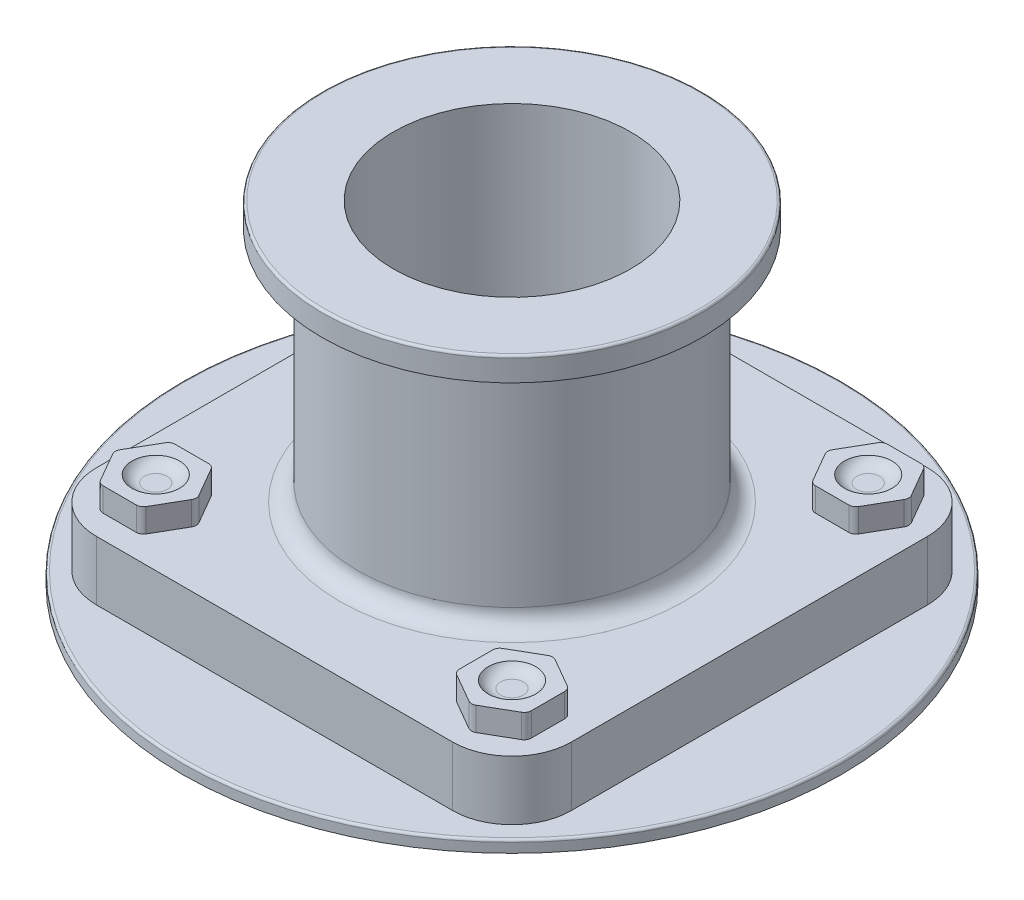
from build123d import *

# Parameters (mm, degrees)
SKETCH1_R                = 277.5
BOSS_EXTRUDE1_DEPTH      = 10
SKETCH2_W                = 400
SKETCH2_H                = 400
BOSS_EXTRUDE2_DEPTH      = 50
FILLET1_R                = 50
SKETCH3_R                = 130
BOSS_EXTRUDE3_DEPTH      = 200
SKETCH4_R                = 160
BOSS_EXTRUDE4_DEPTH      = 20
SKETCH7_R                = 100
CUT_EXTRUDE2_DEPTH       = 200
FILLET3_R                = 15
FILLET4_R                = 2
BOSS_EXTRUDE6_DEPTH      = 20
SKETCH9_R                = 20
CUT_EXTRUDE3_DEPTH       = 6
FILLET5_R                = 12
FILLET6_R                = 6
CIRPATTERN1_COUNT        = 4
FILLET5_OF_CIRPATTERN1_R = 12
FILLET6_OF_CIRPATTERN1_R = 6


with BuildPart() as part:
    # Sketch1 → Boss-Extrude1 (new body)
    with BuildSketch(Plane(origin=(0, 0, 0), x_dir=(1, 0, 0), z_dir=(0, 1, 0))):
        with Locations(Location((0, 0, 0), (0, 0, 270))):
            Circle(SKETCH1_R)
    extrude(amount=BOSS_EXTRUDE1_DEPTH)

    # Sketch2 → Boss-Extrude2 (add)
    with BuildSketch(Plane(origin=(0, 10, 0), x_dir=(1, 0, 0), z_dir=(0, 1, 0))):
        Rectangle(SKETCH2_W, SKETCH2_H)
    extrude(amount=BOSS_EXTRUDE2_DEPTH)

    # Fillet1
    # the kernel refuses this fillet: 50 mm, written as the material it takes off along each edge
    with BuildSketch(Plane(origin=(-200, 10, -200), x_dir=(0, 0, 1), z_dir=(0, 1, 0)), Plane(origin=(-200, 10, 200), x_dir=(1, 0, 0), z_dir=(0, 1, 0)), Plane(origin=(200, 10, -200), x_dir=(-1, 0, 0), z_dir=(0, 1, 0))) as fillet1_piece_1:
        with BuildLine():
            CenterArc((FILLET1_R, FILLET1_R), FILLET1_R, 180, 90)
            Line((0, FILLET1_R), (0, 0))
            Line((0, 0), (FILLET1_R, 0))
        make_face()
    extrude(amount=175, mode=Mode.SUBTRACT)
    with BuildSketch(Plane(origin=(200, 10, 200), x_dir=(-1, 0, 0), z_dir=(0, 1, 0))) as fillet1_piece_2:
        with BuildLine():
            CenterArc((FILLET1_R, -FILLET1_R), FILLET1_R, 90, 90)
            Line((0, -FILLET1_R), (0, 0))
            Line((0, 0), (FILLET1_R, 0))
        make_face()
    extrude(amount=175, mode=Mode.SUBTRACT)

    # Sketch3 → Boss-Extrude3 (add)
    with BuildSketch(Plane(origin=(0, 60, 0), x_dir=(1, 0, 0), z_dir=(0, 1, 0))):
        with Locations(Location((0, 0, 0), (0, 0, 270))):
            Circle(SKETCH3_R)
    extrude(amount=BOSS_EXTRUDE3_DEPTH)

    # Sketch4 → Boss-Extrude4 (add)
    with BuildSketch(Plane(origin=(0, 260, 0), x_dir=(1, 0, 0), z_dir=(0, 1, 0))):
        with Locations(Location((0, 0, 0), (0, 0, 270))):
            Circle(SKETCH4_R)
    extrude(amount=BOSS_EXTRUDE4_DEPTH)

    # Sketch7 → Cut-Extrude2 (cut)
    with BuildSketch(Plane(origin=(0, 280, 0), x_dir=(1, 0, 0), z_dir=(0, 1, 0))):
        with Locations(Location((0, 0, 0), (0, 0, 270))):
            Circle(SKETCH7_R)
    extrude(amount=-CUT_EXTRUDE2_DEPTH, mode=Mode.SUBTRACT)

    # Fillet3
    fillet3_edges = [part.edges().sort_by_distance(p)[0] for p in [
        (0, 60, -130),
    ]]
    fillet(fillet3_edges, radius=FILLET3_R)

    # Fillet4
    fillet4_edges = [part.edges().sort_by_distance(p)[0] for p in [
        (0, 10, -277.5),
        (0, 280, -160),
    ]]
    fillet(fillet4_edges, radius=FILLET4_R)

    # Sketch8 → Boss-Extrude6 (add)
    with BuildSketch(Plane(origin=(0, 60, 0), x_dir=(1, 0, 0), z_dir=(0, 1, 0))):
        Polygon((150, -185), (180.310889132, -167.5), (180.310889132, -132.5), (150, -115), (119.689110868, -132.5), (119.689110868, -167.5), align=None)
    boss_extrude6 = extrude(amount=BOSS_EXTRUDE6_DEPTH)

    # Sketch9 → Cut-Extrude3 (cut)
    with BuildSketch(Plane(origin=(0, 80, 0), x_dir=(1, 0, 0), z_dir=(0, 1, 0))):
        with Locations(Location((150, -150, 0), (0, 0, 270))):
            Circle(SKETCH9_R)
    cut_extrude3 = extrude(amount=-CUT_EXTRUDE3_DEPTH, mode=Mode.SUBTRACT)

    # Fillet5
    # the kernel refuses this fillet: 12 mm, written as the material it adds along each edge
    with BuildSketch(Plane(origin=(150, 74, 150), x_dir=(0, 0, 1), z_dir=(-1, 0, 0))) as fillet5_piece_1:
        with BuildLine():
            CenterArc((9.607695155, 12), FILLET5_R, 270, 60)
            Line((9.607695155, 0), (9.607695155, -0.24))
            Line((9.607695155, -0.24), (20, -0.24))
            Line((20, -0.24), (20.24, 0))
            ThreePointArc((20.24, 0), (20.24, 3), (20.207846097, 5.88))
            Line((20.207846097, 5.88), (20, 6))
        make_face()
    revolve(axis=Axis((150, 74, 150), (0, 1, 0)))

    # Fillet6
    fillet6_edges = [part.edges().sort_by_distance(p)[0] for p in [
        (119.689110868, 70, 167.5),
        (150, 70, 185),
        (180.310889132, 70, 167.5),
        (180.310889132, 70, 132.5),
        (150, 70, 115),
        (119.689110868, 70, 132.5),
    ]]
    fillet(fillet6_edges, radius=FILLET6_R)

    # CirPattern1: Boss-Extrude6, Cut-Extrude3 ×4 about axis
    cirpattern1_axis = Axis((0, 0, 0), (0, 1, 0))
    add([boss_extrude6.rotate(cirpattern1_axis, i * 360 / CIRPATTERN1_COUNT) for i in range(1, CIRPATTERN1_COUNT)])
    add([cut_extrude3.rotate(cirpattern1_axis, i * 360 / CIRPATTERN1_COUNT) for i in range(1, CIRPATTERN1_COUNT)], mode=Mode.SUBTRACT)

    # Fillet5 of CirPattern1
    # the kernel refuses this fillet: 12 mm, written as the material it adds along each edge
    with BuildSketch(Plane(origin=(150, 74, -150), x_dir=(1, 0, 0), z_dir=(0, 0, 1))) as fillet5_of_cirpattern1_piece_1:
        with BuildLine():
            CenterArc((9.607695155, 12), FILLET5_OF_CIRPATTERN1_R, 270, 60)
            Line((9.607695155, 0), (9.607695155, -0.24))
            Line((9.607695155, -0.24), (20, -0.24))
            Line((20, -0.24), (20.24, 0))
            ThreePointArc((20.24, 0), (20.24, 3), (20.207846097, 5.88))
            Line((20.207846097, 5.88), (20, 6))
        make_face()
    revolve(axis=Axis((150, 74, -150), (0, 1, 0)))
    with BuildSketch(Plane(origin=(-150, 74, -150), x_dir=(0, 0, -1), z_dir=(1, 0, 0))) as fillet5_of_cirpattern1_piece_2:
        with BuildLine():
            CenterArc((9.607695155, 12), FILLET5_OF_CIRPATTERN1_R, 270, 60)
            Line((9.607695155, 0), (9.607695155, -0.24))
            Line((9.607695155, -0.24), (20, -0.24))
            Line((20, -0.24), (20.24, 0))
            ThreePointArc((20.24, 0), (20.24, 3), (20.207846097, 5.88))
            Line((20.207846097, 5.88), (20, 6))
        make_face()
    revolve(axis=Axis((-150, 74, -150), (0, 1, 0)))
    with BuildSketch(Plane(origin=(-150, 74, 150), x_dir=(-1, 0, 0), z_dir=(0, 0, -1))) as fillet5_of_cirpattern1_piece_3:
        with BuildLine():
            CenterArc((9.607695155, 12), FILLET5_OF_CIRPATTERN1_R, 270, 60)
            Line((9.607695155, 0), (9.607695155, -0.24))
            Line((9.607695155, -0.24), (20, -0.24))
            Line((20, -0.24), (20.24, 0))
            ThreePointArc((20.24, 0), (20.24, 3), (20.207846097, 5.88))
            Line((20.207846097, 5.88), (20, 6))
        make_face()
    revolve(axis=Axis((-150, 74, 150), (0, 1, 0)))

    # Fillet6 of CirPattern1
    fillet6_of_cirpattern1_edges = [part.edges().sort_by_distance(p)[0] for p in [
        (167.5, 70, -119.689110868),
        (185, 70, -150),
        (167.5, 70, -180.310889132),
        (132.5, 70, -180.310889132),
        (115, 70, -150),
        (132.5, 70, -119.689110868),
        (-119.689110868, 70, -167.5),
        (-150, 70, -185),
        (-180.310889132, 70, -167.5),
        (-180.310889132, 70, -132.5),
        (-150, 70, -115),
        (-119.689110868, 70, -132.5),
        (-167.5, 70, 119.689110868),
        (-185, 70, 150),
        (-167.5, 70, 180.310889132),
        (-132.5, 70, 180.310889132),
        (-115, 70, 150),
        (-132.5, 70, 119.689110868),
    ]]
    fillet(fillet6_of_cirpattern1_edges, radius=FILLET6_OF_CIRPATTERN1_R)


solid = part.part
